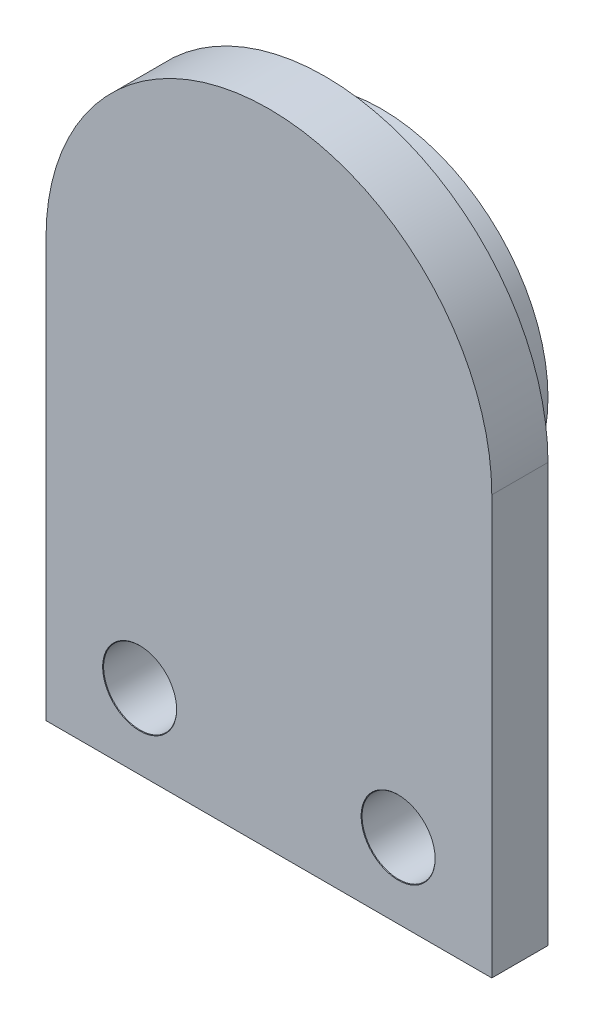
from build123d import *

# Parameters (mm, degrees)
BOSS_EXTRUDE1_DEPTH              = 3
SKETCH2_R                        = 8.9
BOSS_EXTRUDE2_DEPTH              = 3
SKETCH3_R                        = 2
BOSS_EXTRUDE3_DEPTH              = 3
M3_5_CLEARANCE_HOLE1_D           = 3.9
M3_5_CLEARANCE_HOLE1_CSINK_D     = 3.95
M3_5_CLEARANCE_HOLE1_CSINK_ANGLE = 90


with BuildPart() as part:
    # Sketch1 → Boss-Extrude1 (new body)
    with BuildSketch(Plane.XY):
        with BuildLine():
            Line((-11.9, 0), (-11.9, -22.34))
            Line((-11.9, -22.34), (11.9, -22.34))
            Line((11.9, -22.34), (11.9, 0))
            ThreePointArc((11.9, 0), (0, 11.9), (-11.9, 0))
        make_face()
    extrude(amount=BOSS_EXTRUDE1_DEPTH)

    # Sketch2 → Boss-Extrude2 (add)
    with BuildSketch(Plane(origin=(0, 0, 0), x_dir=(-1, 0, 0), z_dir=(0, 0, -1))):
        Circle(SKETCH2_R)
    extrude(amount=BOSS_EXTRUDE2_DEPTH)

    # Sketch3 → Boss-Extrude3 (add)
    with BuildSketch(Plane(origin=(0, 0, -3), x_dir=(-1, 0, 0), z_dir=(0, 0, -1))):
        Circle(SKETCH3_R)
    extrude(amount=BOSS_EXTRUDE3_DEPTH)

    # M3.5 Clearance Hole1 (through all)
    with Locations(Plane(origin=(-6.9, -18.34, 3), x_dir=(1, 0, 0), z_dir=(0, 0, 1))):
        with Locations((0, 0), (13.8, 0)):
            CounterSinkHole(M3_5_CLEARANCE_HOLE1_D / 2, M3_5_CLEARANCE_HOLE1_CSINK_D / 2, counter_sink_angle=M3_5_CLEARANCE_HOLE1_CSINK_ANGLE)


solid = part.part
